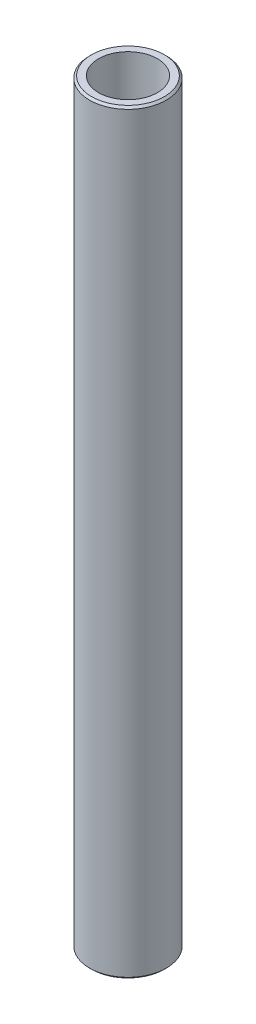
from build123d import *

# Parameters (mm, degrees)
SKETCH1_R           = 30
BOSS_EXTRUDE1_DEPTH = 590.77182304
SKETCH2_R           = 23.009308278
CUT_EXTRUDE1_DEPTH  = 593.293294659
CHAMFER1_SIZE       = 1.585072156


with BuildPart() as part:
    # Sketch1 → Boss-Extrude1 (new body)
    with BuildSketch(Plane(origin=(0, 0, 0), x_dir=(1, 0, 0), z_dir=(0, 1, 0))):
        Circle(SKETCH1_R)
    extrude(amount=BOSS_EXTRUDE1_DEPTH)

    # Sketch2 → Cut-Extrude1 (cut, through all)
    with BuildSketch(Plane(origin=(0, 0, 0), x_dir=(1, 0, 0), z_dir=(0, 1, 0))):
        Circle(SKETCH2_R)
    extrude(amount=CUT_EXTRUDE1_DEPTH, mode=Mode.SUBTRACT)

    # Chamfer1
    chamfer1_edges = [part.edges().sort_by_distance(p)[0] for p in [
        (-30, 590.77182304, 0),
        (-30, 0, 0),
    ]]
    chamfer(chamfer1_edges, length=CHAMFER1_SIZE)


solid = part.part
